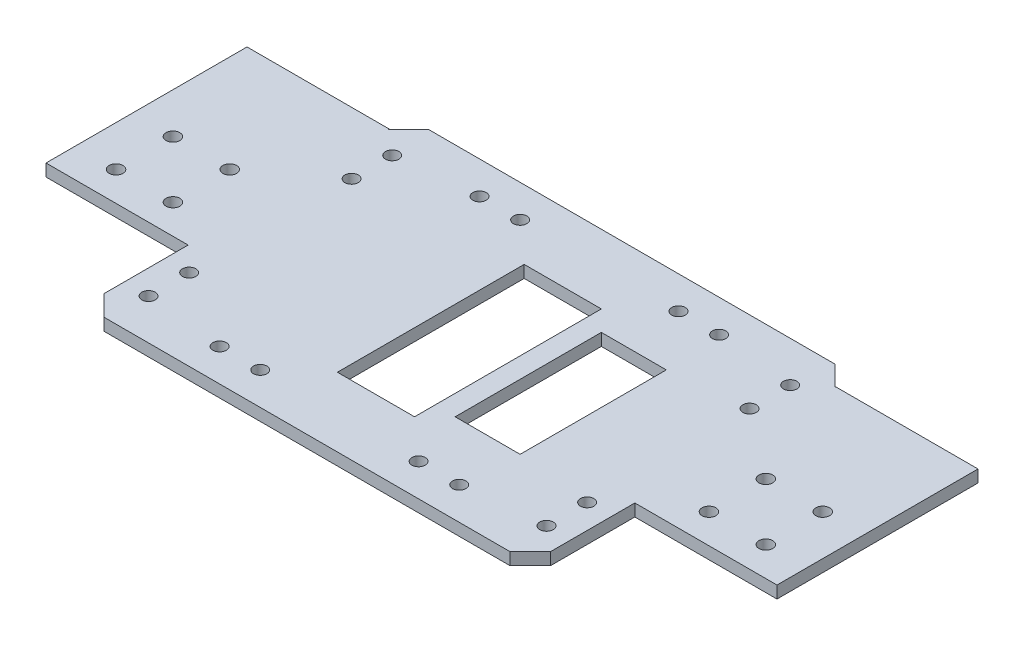
from build123d import *

# Parameters (mm, degrees)
SKETCH1_W           = 19
SKETCH1_H           = 46
SKETCH1_W_2         = 16
SKETCH1_H_2         = 36
SKETCH1_R           = 1.7
BOSS_EXTRUDE1_DEPTH = 3
SKETCH4_R           = 1.65
CUT_EXTRUDE2_DEPTH  = 15
SKETCH5_R           = 1.65
CUT_EXTRUDE3_DEPTH  = 10
CHAMFER1_SIZE       = 5
SKETCH6_W           = 35
SKETCH6_H           = 21
BOSS_EXTRUDE2_DEPTH = 3


with BuildPart() as part:
    # Sketch1 → Boss-Extrude1 (new body)
    with BuildSketch(Plane(origin=(0, 0, 0), x_dir=(1, 0, 0), z_dir=(0, 1, 0))):
        Polygon((55, 40), (-55, 40), (-55, 14.25), (-90, 14.25), (-90, -14.25), (-55, -14.25), (-55, -40), (55, -40), (55, -14.25), (90, -14.25), (90, 14.25), (55, 14.25), align=None)
        Rectangle(SKETCH1_W, SKETCH1_H, mode=Mode.SUBTRACT)
        with Locations((22.5, 0)):
            Rectangle(SKETCH1_W_2, SKETCH1_H_2, mode=Mode.SUBTRACT)
        with Locations((66, 7)):
            Circle(SKETCH1_R, mode=Mode.SUBTRACT)
        with Locations((66, -7)):
            Circle(SKETCH1_R, mode=Mode.SUBTRACT)
        with Locations((80, -7)):
            Circle(SKETCH1_R, mode=Mode.SUBTRACT)
        with Locations((-80, -7)):
            Circle(SKETCH1_R, mode=Mode.SUBTRACT)
        with Locations((-66, -7)):
            Circle(SKETCH1_R, mode=Mode.SUBTRACT)
        with Locations((-66, 7)):
            Circle(SKETCH1_R, mode=Mode.SUBTRACT)
        with Locations((80, 7)):
            Circle(SKETCH1_R, mode=Mode.SUBTRACT)
        with Locations((-80, 7)):
            Circle(SKETCH1_R, mode=Mode.SUBTRACT)
    extrude(amount=BOSS_EXTRUDE1_DEPTH)

    # Sketch4 → Cut-Extrude2 (cut)
    with BuildSketch(Plane(origin=(0, 3, 0), x_dir=(1, 0, 0), z_dir=(0, 1, 0))):
        with Locations((29.5, 32)):
            Circle(SKETCH4_R)
        with Locations((19.5, 32)):
            Circle(SKETCH4_R)
        with Locations((19.5, -32)):
            Circle(SKETCH4_R)
        with Locations((29.5, -32)):
            Circle(SKETCH4_R)
        with Locations((-19.5, 32)):
            Circle(SKETCH4_R)
        with Locations((-29.5, 32)):
            Circle(SKETCH4_R)
        with Locations((-29.5, -32)):
            Circle(SKETCH4_R)
        with Locations((-19.5, -32)):
            Circle(SKETCH4_R)
    extrude(amount=-CUT_EXTRUDE2_DEPTH, mode=Mode.SUBTRACT)

    # Sketch5 → Cut-Extrude3 (cut)
    with BuildSketch(Plane(origin=(0, 3, 0), x_dir=(1, 0, 0), z_dir=(0, 1, 0))):
        with Locations((-49, 30)):
            Circle(SKETCH5_R)
        with Locations((-49, -20)):
            Circle(SKETCH5_R)
        with Locations((-49, -30)):
            Circle(SKETCH5_R)
        with Locations((-49, 20)):
            Circle(SKETCH5_R)
        with Locations((49, 20)):
            Circle(SKETCH5_R)
        with Locations((49, -30)):
            Circle(SKETCH5_R)
        with Locations((49, -20)):
            Circle(SKETCH5_R)
        with Locations((49, 30)):
            Circle(SKETCH5_R)
    extrude(amount=-CUT_EXTRUDE3_DEPTH, mode=Mode.SUBTRACT)

    # Chamfer1
    chamfer1_edges = [part.edges().sort_by_distance(p)[0] for p in [
        (-55, 1.5, -40),
        (55, 1.5, -40),
        (55, 1.5, 40),
        (-55, 1.5, 40),
    ]]
    chamfer(chamfer1_edges, length=CHAMFER1_SIZE)

    # Sketch6 → Boss-Extrude2 (add)
    with BuildSketch(Plane(origin=(0, 3, 0), x_dir=(1, 0, 0), z_dir=(0, 1, 0))):
        with Locations((-72.5, 24.75)):
            Rectangle(SKETCH6_W, SKETCH6_H)
        with Locations((72.5, 24.75)):
            Rectangle(SKETCH6_W, SKETCH6_H)
    extrude(amount=-BOSS_EXTRUDE2_DEPTH)


solid = part.part
